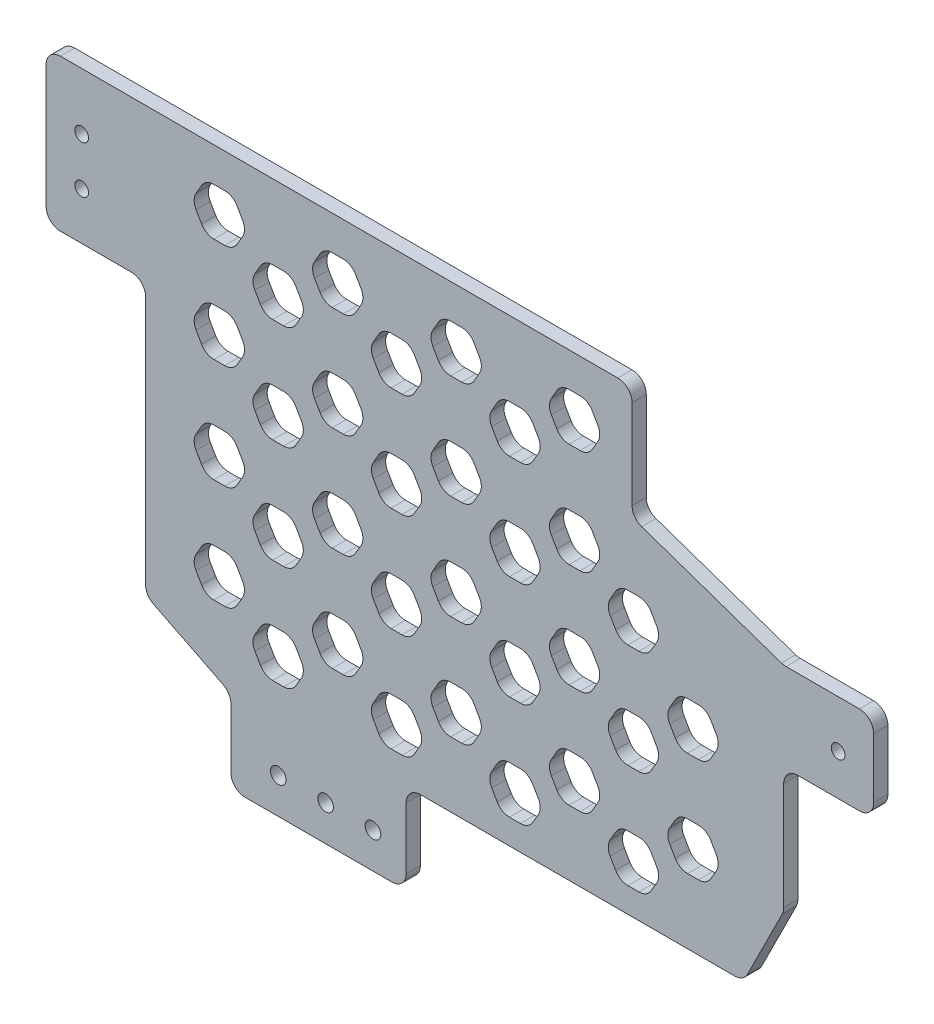
from build123d import *

# Parameters (mm, degrees)
EXTRUDE_1_DEPTH     = 3
SKETCH_2_R          = 1.45
CUT_EXTRUDE_1_DEPTH = 514.000260576
CUT_EXTRUDE_2_DEPTH = 10
FILLET_3_R          = 3
SKETCH_4_R          = 1.65
CUT_EXTRUDE_3_DEPTH = 514.000207468
CUT_EXTRUDE_4_DEPTH = 514.000207468
FILLET_4_R          = 3
SKETCH_8_W          = 111.82145061
SKETCH_8_H          = 106.802816081
CUT_EXTRUDE_5_DEPTH = 514.000207468
FILLET_5_R          = 3


with BuildPart() as part:
    # 草图1 → 凸台-拉伸1 (new body)
    with BuildSketch(Plane.XY):
        Polygon((-15, -266.5), (140.69848481, -266.5), (140.69848481, -301.5), (159.698712266, -301.5), (159.699772544, -320.145898034), (140.69848481, -320.145898034), (140.69848481, -346.55875847), (132.227864045, -363.5), (61, -363.5), (61, -487.5), (49, -487.5), (49, -466.5), (4, -466.5), (4, -449.5), (-15, -449.5), (-15, -396.5), (0.94427191, -396.5), (24, -384.972135955), (24, -365.027864045), (6, -356.027864045), (6, -298.5), (-15, -298.5), align=None)
    extrude(amount=EXTRUDE_1_DEPTH)

    # 草图2 → 切除-拉伸1 (cut, through all)
    with BuildSketch(Plane.XY.offset(3)):
        with Locations((-7.5, -415)):
            Circle(SKETCH_2_R)
        with Locations((-7.5, -439.5)):
            Circle(SKETCH_2_R)
        with Locations((56, -480)):
            Circle(SKETCH_2_R)
        with Locations((152.199280893, -311.5)):
            Circle(SKETCH_2_R)
        with Locations((-7.5, -288.5)):
            Circle(SKETCH_2_R)
        with Locations((-7.5, -278.5)):
            Circle(SKETCH_2_R)
    extrude(amount=-CUT_EXTRUDE_1_DEPTH, mode=Mode.SUBTRACT)

    # 草图3 → 切除-拉伸2 (cut)
    with BuildSketch(Plane.XY.offset(3)):
        Polygon((140.69848481, -266.5), (108.69848481, -266.5), (108.69848481, -290.465517241), (140.69848481, -301.5), align=None)
    extrude(amount=-CUT_EXTRUDE_2_DEPTH, mode=Mode.SUBTRACT)

    # 圆角3
    fillet_3_edges = [part.edges().sort_by_distance(p)[0] for p in [
        (159.699772544, -320.145898034, 1.5),
        (140.69848481, -320.145898034, 1.5),
        (61, -487.5, 1.5),
        (49, -487.5, 1.5),
        (49, -466.5, 1.5),
        (4, -466.5, 1.5),
        (4, -449.5, 1.5),
        (-15, -449.5, 1.5),
        (-15, -396.5, 1.5),
        (0.94427191, -396.5, 1.5),
        (24, -384.972135955, 1.5),
        (24, -365.027864045, 1.5),
        (6, -356.027864045, 1.5),
        (6, -298.5, 1.5),
        (-15, -298.5, 1.5),
        (-15, -266.5, 1.5),
        (159.698712266, -301.5, 1.5),
        (140.69848481, -346.55875847, 1.5),
        (132.227864045, -363.5, 1.5),
        (61, -363.5, 1.5),
        (108.69848481, -266.5, 1.5),
        (108.69848481, -290.465517241, 1.5),
        (140.69848481, -301.5, 1.5),
    ]]
    fillet(fillet_3_edges, radius=FILLET_3_R)

    # 草图4 → 切除-拉伸3 (cut, through all)
    with BuildSketch(Plane.XY.offset(3)):
        with Locations((54, -375)):
            Circle(SKETCH_4_R)
        with Locations((44, -375)):
            Circle(SKETCH_4_R)
        with Locations((34, -375)):
            Circle(SKETCH_4_R)
    extrude(amount=-CUT_EXTRUDE_3_DEPTH, mode=Mode.SUBTRACT)

    # 草图5 → 切除-拉伸4 (cut, through all)
    with BuildSketch(Plane.XY.offset(3)):
        Polygon((52.336464045, -278.740553297), (49.449712699, -273.740553297), (43.676210008, -273.740553297), (40.789458662, -278.740553297), (43.676210008, -283.740553297), (49.449712699, -283.740553297), align=None)
        Polygon((27.336464045, -278.740553297), (24.449712699, -273.740553297), (18.676210008, -273.740553297), (15.789458662, -278.740553297), (18.676210008, -283.740553297), (24.449712699, -283.740553297), align=None)
        Polygon((39.75336779, -287.233845139), (36.866616444, -282.233845139), (31.093113753, -282.233845139), (28.206362407, -287.233845139), (31.093113753, -292.233845139), (36.866616444, -292.233845139), align=None)
        Polygon((64.75336779, -287.233845139), (61.866616444, -282.233845139), (56.093113753, -282.233845139), (53.206362407, -287.233845139), (56.093113753, -292.233845139), (61.866616444, -292.233845139), align=None)
        Polygon((77.336464045, -278.740553297), (74.449712699, -273.740553297), (68.676210008, -273.740553297), (65.789458662, -278.740553297), (68.676210008, -283.740553297), (74.449712699, -283.740553297), align=None)
        Polygon((89.75336779, -287.233845139), (86.866616444, -282.233845139), (81.093113753, -282.233845139), (78.206362407, -287.233845139), (81.093113753, -292.233845139), (86.866616444, -292.233845139), align=None)
        Polygon((102.336464045, -278.740553297), (99.449712699, -273.740553297), (93.676210008, -273.740553297), (90.789458662, -278.740553297), (93.676210008, -283.740553297), (99.449712699, -283.740553297), align=None)
        Polygon((52.336464045, -300.740553297), (49.449712699, -295.740553297), (43.676210008, -295.740553297), (40.789458662, -300.740553297), (43.676210008, -305.740553297), (49.449712699, -305.740553297), align=None)
        Polygon((64.75336779, -309.233845139), (61.866616444, -304.233845139), (56.093113753, -304.233845139), (53.206362407, -309.233845139), (56.093113753, -314.233845139), (61.866616444, -314.233845139), align=None)
        Polygon((77.336464045, -300.740553297), (74.449712699, -295.740553297), (68.676210008, -295.740553297), (65.789458662, -300.740553297), (68.676210008, -305.740553297), (74.449712699, -305.740553297), align=None)
        Polygon((89.75336779, -309.233845139), (86.866616444, -304.233845139), (81.093113753, -304.233845139), (78.206362407, -309.233845139), (81.093113753, -314.233845139), (86.866616444, -314.233845139), align=None)
        Polygon((102.336464045, -300.740553297), (99.449712699, -295.740553297), (93.676210008, -295.740553297), (90.789458662, -300.740553297), (93.676210008, -305.740553297), (99.449712699, -305.740553297), align=None)
        Polygon((114.75336779, -309.233845139), (111.866616444, -304.233845139), (106.093113753, -304.233845139), (103.206362407, -309.233845139), (106.093113753, -314.233845139), (111.866616444, -314.233845139), align=None)
        Polygon((52.336464045, -322.740553297), (49.449712699, -317.740553297), (43.676210008, -317.740553297), (40.789458662, -322.740553297), (43.676210008, -327.740553297), (49.449712699, -327.740553297), align=None)
        Polygon((64.75336779, -331.233845139), (61.866616444, -326.233845139), (56.093113753, -326.233845139), (53.206362407, -331.233845139), (56.093113753, -336.233845139), (61.866616444, -336.233845139), align=None)
        Polygon((77.336464045, -322.740553297), (74.449712699, -317.740553297), (68.676210008, -317.740553297), (65.789458662, -322.740553297), (68.676210008, -327.740553297), (74.449712699, -327.740553297), align=None)
        Polygon((89.75336779, -331.233845139), (86.866616444, -326.233845139), (81.093113753, -326.233845139), (78.206362407, -331.233845139), (81.093113753, -336.233845139), (86.866616444, -336.233845139), align=None)
        Polygon((102.336464045, -322.740553297), (99.449712699, -317.740553297), (93.676210008, -317.740553297), (90.789458662, -322.740553297), (93.676210008, -327.740553297), (99.449712699, -327.740553297), align=None)
        Polygon((114.75336779, -331.233845139), (111.866616444, -326.233845139), (106.093113753, -326.233845139), (103.206362407, -331.233845139), (106.093113753, -336.233845139), (111.866616444, -336.233845139), align=None)
        Polygon((52.336464045, -344.740553297), (49.449712699, -339.740553297), (43.676210008, -339.740553297), (40.789458662, -344.740553297), (43.676210008, -349.740553297), (49.449712699, -349.740553297), align=None)
        Polygon((64.75336779, -353.233845139), (61.866616444, -348.233845139), (56.093113753, -348.233845139), (53.206362407, -353.233845139), (56.093113753, -358.233845139), (61.866616444, -358.233845139), align=None)
        Polygon((77.336464045, -344.740553297), (74.449712699, -339.740553297), (68.676210008, -339.740553297), (65.789458662, -344.740553297), (68.676210008, -349.740553297), (74.449712699, -349.740553297), align=None)
        Polygon((89.75336779, -353.233845139), (86.866616444, -348.233845139), (81.093113753, -348.233845139), (78.206362407, -353.233845139), (81.093113753, -358.233845139), (86.866616444, -358.233845139), align=None)
        Polygon((102.336464045, -344.740553297), (99.449712699, -339.740553297), (93.676210008, -339.740553297), (90.789458662, -344.740553297), (93.676210008, -349.740553297), (99.449712699, -349.740553297), align=None)
        Polygon((114.75336779, -353.233845139), (111.866616444, -348.233845139), (106.093113753, -348.233845139), (103.206362407, -353.233845139), (106.093113753, -358.233845139), (111.866616444, -358.233845139), align=None)
        Polygon((27.336464045, -300.740553297), (24.449712699, -295.740553297), (18.676210008, -295.740553297), (15.789458662, -300.740553297), (18.676210008, -305.740553297), (24.449712699, -305.740553297), align=None)
        Polygon((39.75336779, -309.233845139), (36.866616444, -304.233845139), (31.093113753, -304.233845139), (28.206362407, -309.233845139), (31.093113753, -314.233845139), (36.866616444, -314.233845139), align=None)
        Polygon((27.336464045, -322.740553297), (24.449712699, -317.740553297), (18.676210008, -317.740553297), (15.789458662, -322.740553297), (18.676210008, -327.740553297), (24.449712699, -327.740553297), align=None)
        Polygon((39.75336779, -331.233845139), (36.866616444, -326.233845139), (31.093113753, -326.233845139), (28.206362407, -331.233845139), (31.093113753, -336.233845139), (36.866616444, -336.233845139), align=None)
        Polygon((27.336464045, -344.740553297), (24.449712699, -339.740553297), (18.676210008, -339.740553297), (15.789458662, -344.740553297), (18.676210008, -349.740553297), (24.449712699, -349.740553297), align=None)
        Polygon((39.75336779, -353.233845139), (36.866616444, -348.233845139), (31.093113753, -348.233845139), (28.206362407, -353.233845139), (31.093113753, -358.233845139), (36.866616444, -358.233845139), align=None)
        Polygon((40.944307749, -403.935184785), (38.057556403, -398.935184785), (32.284053711, -398.935184785), (29.397302365, -403.935184785), (32.284053711, -408.935184785), (38.057556403, -408.935184785), align=None)
        Polygon((15.944307749, -403.935184785), (13.057556403, -398.935184785), (7.284053711, -398.935184785), (4.397302365, -403.935184785), (7.284053711, -408.935184785), (13.057556403, -408.935184785), align=None)
        Polygon((27.832793266, -413.343723844), (24.94604192, -408.343723844), (19.172539229, -408.343723844), (16.285787883, -413.343723844), (19.172539229, -418.343723844), (24.94604192, -418.343723844), align=None)
        Polygon((52.832793266, -413.343723844), (49.94604192, -408.343723844), (44.172539229, -408.343723844), (41.285787883, -413.343723844), (44.172539229, -418.343723844), (49.94604192, -418.343723844), align=None)
        Polygon((40.944307749, -423.935184785), (38.057556403, -418.935184785), (32.284053711, -418.935184785), (29.397302365, -423.935184785), (32.284053711, -428.935184785), (38.057556403, -428.935184785), align=None)
        Polygon((52.832793266, -433.343723844), (49.94604192, -428.343723844), (44.172539229, -428.343723844), (41.285787883, -433.343723844), (44.172539229, -438.343723844), (49.94604192, -438.343723844), align=None)
        Polygon((40.944307749, -443.935184785), (38.057556403, -438.935184785), (32.284053711, -438.935184785), (29.397302365, -443.935184785), (32.284053711, -448.935184785), (38.057556403, -448.935184785), align=None)
        Polygon((52.832793266, -453.343723844), (49.94604192, -448.343723844), (44.172539229, -448.343723844), (41.285787883, -453.343723844), (44.172539229, -458.343723844), (49.94604192, -458.343723844), align=None)
        Polygon((15.944307749, -423.935184785), (13.057556403, -418.935184785), (7.284053711, -418.935184785), (4.397302365, -423.935184785), (7.284053711, -428.935184785), (13.057556403, -428.935184785), align=None)
        Polygon((27.832793266, -433.343723844), (24.94604192, -428.343723844), (19.172539229, -428.343723844), (16.285787883, -433.343723844), (19.172539229, -438.343723844), (24.94604192, -438.343723844), align=None)
        Polygon((15.944307749, -443.935184785), (13.057556403, -438.935184785), (7.284053711, -438.935184785), (4.397302365, -443.935184785), (7.284053711, -448.935184785), (13.057556403, -448.935184785), align=None)
        Polygon((27.832793266, -453.343723844), (24.94604192, -448.343723844), (19.172539229, -448.343723844), (16.285787883, -453.343723844), (19.172539229, -458.343723844), (24.94604192, -458.343723844), align=None)
        Polygon((52.832793266, -396.343723844), (49.94604192, -391.343723844), (44.172539229, -391.343723844), (41.285787883, -396.343723844), (44.172539229, -401.343723844), (49.94604192, -401.343723844), align=None)
        Polygon((127.336464045, -322.740553297), (124.449712699, -317.740553297), (118.676210008, -317.740553297), (115.789458662, -322.740553297), (118.676210008, -327.740553297), (124.449712699, -327.740553297), align=None)
        Polygon((127.336464045, -344.740553297), (124.449712699, -339.740553297), (118.676210008, -339.740553297), (115.789458662, -344.740553297), (118.676210008, -349.740553297), (124.449712699, -349.740553297), align=None)
    extrude(amount=-CUT_EXTRUDE_4_DEPTH, mode=Mode.SUBTRACT)

    # 圆角4
    fillet_4_edges = [part.edges().sort_by_distance(p)[0] for p in [
        (24.449712699, -283.740553297, 1.5),
        (18.676210008, -283.740553297, 1.5),
        (15.789458662, -278.740553297, 1.5),
        (24.449712699, -273.740553297, 1.5),
        (27.336464045, -278.740553297, 1.5),
        (49.94604192, -438.343723844, 1.5),
        (44.172539229, -438.343723844, 1.5),
        (41.285787883, -433.343723844, 1.5),
        (44.172539229, -428.343723844, 1.5),
        (49.94604192, -428.343723844, 1.5),
        (52.832793266, -433.343723844, 1.5),
        (38.057556403, -448.935184785, 1.5),
        (32.284053711, -448.935184785, 1.5),
        (29.397302365, -443.935184785, 1.5),
        (32.284053711, -438.935184785, 1.5),
        (38.057556403, -438.935184785, 1.5),
        (40.944307749, -443.935184785, 1.5),
        (49.94604192, -458.343723844, 1.5),
        (44.172539229, -458.343723844, 1.5),
        (41.285787883, -453.343723844, 1.5),
        (44.172539229, -448.343723844, 1.5),
        (49.94604192, -448.343723844, 1.5),
        (52.832793266, -453.343723844, 1.5),
        (13.057556403, -428.935184785, 1.5),
        (7.284053711, -428.935184785, 1.5),
        (4.397302365, -423.935184785, 1.5),
        (7.284053711, -418.935184785, 1.5),
        (13.057556403, -418.935184785, 1.5),
        (15.944307749, -423.935184785, 1.5),
        (38.057556403, -408.935184785, 1.5),
        (32.284053711, -408.935184785, 1.5),
        (29.397302365, -403.935184785, 1.5),
        (32.284053711, -398.935184785, 1.5),
        (38.057556403, -398.935184785, 1.5),
        (40.944307749, -403.935184785, 1.5),
        (49.94604192, -418.343723844, 1.5),
        (44.172539229, -418.343723844, 1.5),
        (41.285787883, -413.343723844, 1.5),
        (44.172539229, -408.343723844, 1.5),
        (49.94604192, -408.343723844, 1.5),
        (52.832793266, -413.343723844, 1.5),
        (38.057556403, -428.935184785, 1.5),
        (32.284053711, -428.935184785, 1.5),
        (29.397302365, -423.935184785, 1.5),
        (32.284053711, -418.935184785, 1.5),
        (38.057556403, -418.935184785, 1.5),
        (40.944307749, -423.935184785, 1.5),
        (49.94604192, -401.343723844, 1.5),
        (44.172539229, -401.343723844, 1.5),
        (41.285787883, -396.343723844, 1.5),
        (44.172539229, -391.343723844, 1.5),
        (49.94604192, -391.343723844, 1.5),
        (52.832793266, -396.343723844, 1.5),
        (24.94604192, -458.343723844, 1.5),
        (19.172539229, -458.343723844, 1.5),
        (16.285787883, -453.343723844, 1.5),
        (19.172539229, -448.343723844, 1.5),
        (24.94604192, -448.343723844, 1.5),
        (27.832793266, -453.343723844, 1.5),
        (13.057556403, -448.935184785, 1.5),
        (7.284053711, -448.935184785, 1.5),
        (4.397302365, -443.935184785, 1.5),
        (7.284053711, -438.935184785, 1.5),
        (13.057556403, -438.935184785, 1.5),
        (15.944307749, -443.935184785, 1.5),
        (24.94604192, -438.343723844, 1.5),
        (19.172539229, -438.343723844, 1.5),
        (16.285787883, -433.343723844, 1.5),
        (19.172539229, -428.343723844, 1.5),
        (24.94604192, -428.343723844, 1.5),
        (27.832793266, -433.343723844, 1.5),
        (124.449712699, -327.740553297, 1.5),
        (118.676210008, -327.740553297, 1.5),
        (115.789458662, -322.740553297, 1.5),
        (118.676210008, -317.740553297, 1.5),
        (124.449712699, -317.740553297, 1.5),
        (127.336464045, -322.740553297, 1.5),
        (124.449712699, -349.740553297, 1.5),
        (118.676210008, -349.740553297, 1.5),
        (115.789458662, -344.740553297, 1.5),
        (118.676210008, -339.740553297, 1.5),
        (124.449712699, -339.740553297, 1.5),
        (127.336464045, -344.740553297, 1.5),
        (61.866616444, -314.233845139, 1.5),
        (56.093113753, -314.233845139, 1.5),
        (53.206362407, -309.233845139, 1.5),
        (56.093113753, -304.233845139, 1.5),
        (61.866616444, -304.233845139, 1.5),
        (64.75336779, -309.233845139, 1.5),
        (74.449712699, -305.740553297, 1.5),
        (68.676210008, -305.740553297, 1.5),
        (65.789458662, -300.740553297, 1.5),
        (68.676210008, -295.740553297, 1.5),
        (74.449712699, -295.740553297, 1.5),
        (77.336464045, -300.740553297, 1.5),
        (86.866616444, -314.233845139, 1.5),
        (81.093113753, -314.233845139, 1.5),
        (78.206362407, -309.233845139, 1.5),
        (81.093113753, -304.233845139, 1.5),
        (86.866616444, -304.233845139, 1.5),
        (89.75336779, -309.233845139, 1.5),
        (99.449712699, -305.740553297, 1.5),
        (93.676210008, -305.740553297, 1.5),
        (90.789458662, -300.740553297, 1.5),
        (93.676210008, -295.740553297, 1.5),
        (99.449712699, -295.740553297, 1.5),
        (102.336464045, -300.740553297, 1.5),
        (74.449712699, -327.740553297, 1.5),
        (68.676210008, -327.740553297, 1.5),
        (65.789458662, -322.740553297, 1.5),
        (68.676210008, -317.740553297, 1.5),
        (74.449712699, -317.740553297, 1.5),
        (77.336464045, -322.740553297, 1.5),
        (61.866616444, -336.233845139, 1.5),
        (56.093113753, -336.233845139, 1.5),
        (53.206362407, -331.233845139, 1.5),
        (56.093113753, -326.233845139, 1.5),
        (61.866616444, -326.233845139, 1.5),
        (64.75336779, -331.233845139, 1.5),
        (49.449712699, -327.740553297, 1.5),
        (43.676210008, -327.740553297, 1.5),
        (40.789458662, -322.740553297, 1.5),
        (43.676210008, -317.740553297, 1.5),
        (49.449712699, -317.740553297, 1.5),
        (52.336464045, -322.740553297, 1.5),
        (111.866616444, -314.233845139, 1.5),
        (106.093113753, -314.233845139, 1.5),
        (103.206362407, -309.233845139, 1.5),
        (106.093113753, -304.233845139, 1.5),
        (111.866616444, -304.233845139, 1.5),
        (114.75336779, -309.233845139, 1.5),
        (49.449712699, -283.740553297, 1.5),
        (43.676210008, -283.740553297, 1.5),
        (40.789458662, -278.740553297, 1.5),
        (49.449712699, -273.740553297, 1.5),
        (52.336464045, -278.740553297, 1.5),
        (36.866616444, -292.233845139, 1.5),
        (31.093113753, -292.233845139, 1.5),
        (28.206362407, -287.233845139, 1.5),
        (31.093113753, -282.233845139, 1.5),
        (36.866616444, -282.233845139, 1.5),
        (39.75336779, -287.233845139, 1.5),
        (61.866616444, -292.233845139, 1.5),
        (56.093113753, -292.233845139, 1.5),
        (53.206362407, -287.233845139, 1.5),
        (56.093113753, -282.233845139, 1.5),
        (61.866616444, -282.233845139, 1.5),
        (64.75336779, -287.233845139, 1.5),
        (74.449712699, -283.740553297, 1.5),
        (68.676210008, -283.740553297, 1.5),
        (65.789458662, -278.740553297, 1.5),
        (68.676210008, -273.740553297, 1.5),
        (74.449712699, -273.740553297, 1.5),
        (77.336464045, -278.740553297, 1.5),
        (86.866616444, -292.233845139, 1.5),
        (81.093113753, -292.233845139, 1.5),
        (78.206362407, -287.233845139, 1.5),
        (81.093113753, -282.233845139, 1.5),
        (86.866616444, -282.233845139, 1.5),
        (89.75336779, -287.233845139, 1.5),
        (99.449712699, -283.740553297, 1.5),
        (93.676210008, -283.740553297, 1.5),
        (90.789458662, -278.740553297, 1.5),
        (93.676210008, -273.740553297, 1.5),
        (99.449712699, -273.740553297, 1.5),
        (102.336464045, -278.740553297, 1.5),
        (13.057556403, -408.935184785, 1.5),
        (7.284053711, -408.935184785, 1.5),
        (4.397302365, -403.935184785, 1.5),
        (7.284053711, -398.935184785, 1.5),
        (13.057556403, -398.935184785, 1.5),
        (15.944307749, -403.935184785, 1.5),
        (49.449712699, -305.740553297, 1.5),
        (43.676210008, -305.740553297, 1.5),
        (40.789458662, -300.740553297, 1.5),
        (43.676210008, -295.740553297, 1.5),
        (49.449712699, -295.740553297, 1.5),
        (52.336464045, -300.740553297, 1.5),
        (24.449712699, -327.740553297, 1.5),
        (18.676210008, -327.740553297, 1.5),
        (15.789458662, -322.740553297, 1.5),
        (18.676210008, -317.740553297, 1.5),
        (24.449712699, -317.740553297, 1.5),
        (27.336464045, -322.740553297, 1.5),
        (36.866616444, -314.233845139, 1.5),
        (31.093113753, -314.233845139, 1.5),
        (28.206362407, -309.233845139, 1.5),
        (31.093113753, -304.233845139, 1.5),
        (36.866616444, -304.233845139, 1.5),
        (39.75336779, -309.233845139, 1.5),
        (24.449712699, -305.740553297, 1.5),
        (18.676210008, -305.740553297, 1.5),
        (15.789458662, -300.740553297, 1.5),
        (18.676210008, -295.740553297, 1.5),
        (24.449712699, -295.740553297, 1.5),
        (27.336464045, -300.740553297, 1.5),
        (111.866616444, -358.233845139, 1.5),
        (106.093113753, -358.233845139, 1.5),
        (103.206362407, -353.233845139, 1.5),
        (106.093113753, -348.233845139, 1.5),
        (111.866616444, -348.233845139, 1.5),
        (114.75336779, -353.233845139, 1.5),
        (24.94604192, -418.343723844, 1.5),
        (19.172539229, -418.343723844, 1.5),
        (16.285787883, -413.343723844, 1.5),
        (19.172539229, -408.343723844, 1.5),
        (24.94604192, -408.343723844, 1.5),
        (27.832793266, -413.343723844, 1.5),
        (36.866616444, -358.233845139, 1.5),
        (31.093113753, -358.233845139, 1.5),
        (28.206362407, -353.233845139, 1.5),
        (31.093113753, -348.233845139, 1.5),
        (36.866616444, -348.233845139, 1.5),
        (39.75336779, -353.233845139, 1.5),
        (24.449712699, -349.740553297, 1.5),
        (18.676210008, -349.740553297, 1.5),
        (15.789458662, -344.740553297, 1.5),
        (18.676210008, -339.740553297, 1.5),
        (24.449712699, -339.740553297, 1.5),
        (27.336464045, -344.740553297, 1.5),
        (36.866616444, -336.233845139, 1.5),
        (31.093113753, -336.233845139, 1.5),
        (28.206362407, -331.233845139, 1.5),
        (31.093113753, -326.233845139, 1.5),
        (36.866616444, -326.233845139, 1.5),
        (39.75336779, -331.233845139, 1.5),
        (49.449712699, -349.740553297, 1.5),
        (43.676210008, -349.740553297, 1.5),
        (40.789458662, -344.740553297, 1.5),
        (43.676210008, -339.740553297, 1.5),
        (49.449712699, -339.740553297, 1.5),
        (52.336464045, -344.740553297, 1.5),
        (111.866616444, -336.233845139, 1.5),
        (106.093113753, -336.233845139, 1.5),
        (103.206362407, -331.233845139, 1.5),
        (106.093113753, -326.233845139, 1.5),
        (111.866616444, -326.233845139, 1.5),
        (114.75336779, -331.233845139, 1.5),
        (99.449712699, -327.740553297, 1.5),
        (93.676210008, -327.740553297, 1.5),
        (90.789458662, -322.740553297, 1.5),
        (93.676210008, -317.740553297, 1.5),
        (99.449712699, -317.740553297, 1.5),
        (102.336464045, -322.740553297, 1.5),
        (86.866616444, -336.233845139, 1.5),
        (81.093113753, -336.233845139, 1.5),
        (78.206362407, -331.233845139, 1.5),
        (81.093113753, -326.233845139, 1.5),
        (86.866616444, -326.233845139, 1.5),
        (89.75336779, -331.233845139, 1.5),
        (61.866616444, -358.233845139, 1.5),
        (56.093113753, -358.233845139, 1.5),
        (53.206362407, -353.233845139, 1.5),
        (56.093113753, -348.233845139, 1.5),
        (61.866616444, -348.233845139, 1.5),
        (64.75336779, -353.233845139, 1.5),
        (74.449712699, -349.740553297, 1.5),
        (68.676210008, -349.740553297, 1.5),
        (65.789458662, -344.740553297, 1.5),
        (68.676210008, -339.740553297, 1.5),
        (74.449712699, -339.740553297, 1.5),
        (77.336464045, -344.740553297, 1.5),
        (86.866616444, -358.233845139, 1.5),
        (81.093113753, -358.233845139, 1.5),
        (78.206362407, -353.233845139, 1.5),
        (81.093113753, -348.233845139, 1.5),
        (86.866616444, -348.233845139, 1.5),
        (89.75336779, -353.233845139, 1.5),
        (99.449712699, -349.740553297, 1.5),
        (93.676210008, -349.740553297, 1.5),
        (90.789458662, -344.740553297, 1.5),
        (93.676210008, -339.740553297, 1.5),
        (99.449712699, -339.740553297, 1.5),
        (102.336464045, -344.740553297, 1.5),
        (43.676210008, -273.740553297, 1.5),
        (18.676210008, -273.740553297, 1.5),
    ]]
    fillet(fillet_4_edges, radius=FILLET_4_R)

    # 草图8 → 切除-拉伸5 (cut, through all)
    with BuildSketch(Plane.XY.offset(3)):
        with Locations((36.435197622, -435.90140804)):
            Rectangle(SKETCH_8_W, SKETCH_8_H)
    extrude(amount=-CUT_EXTRUDE_5_DEPTH, mode=Mode.SUBTRACT)

    # 圆角5
    fillet_5_edges = [part.edges().sort_by_distance(p)[0] for p in [
        (61, -382.5, 1.5),
        (24, -382.5, 1.5),
    ]]
    fillet(fillet_5_edges, radius=FILLET_5_R)


solid = part.part
